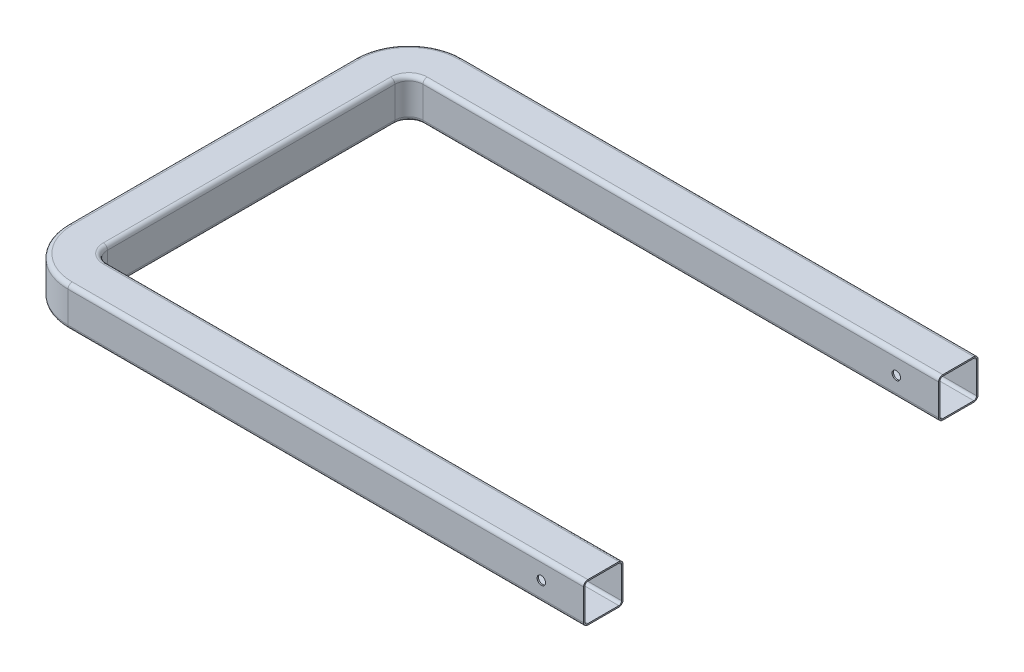
from build123d import *

# Parameters (mm, degrees)
CUT_EXTRUDE1_DEPTH      = 807.538695741
CUT_EXTRUDE1_DEPTH_BACK = 807.538695741
SKETCH3_R               = 5


with BuildPart() as part:
    # Sweep-Thin1: sweep along a path in Sketch1
    with BuildLine(Plane(origin=(0, 0, 0), x_dir=(1, 0, 0), z_dir=(0, 1, 0))) as sweep_thin1_path:
        Line((0, 0), (-610, 0))
        ThreePointArc((-610, 0), (-638.284271247, 11.715728753), (-650, 40))
        Line((-650, 40), (-650, 380))
        ThreePointArc((-650, 380), (-638.284271247, 408.284271247), (-610, 420))
        Line((-610, 420), (0, 420))
    # Sketch2 → Sweep-Thin1 (sweep)
    with BuildSketch(Plane(origin=(0, 0, 0), x_dir=(0, 0, -1), z_dir=(1, 0, 0))):
        with BuildLine():
            Line((18.35, 23.35), (-18.35, 23.35))
            ThreePointArc((-18.35, 23.35), (-21.885533906, 21.885533906), (-23.35, 18.35))
            Line((-23.35, 18.35), (-23.35, -18.35))
            ThreePointArc((-23.35, -18.35), (-21.885533906, -21.885533906), (-18.35, -23.35))
            Line((-18.35, -23.35), (18.35, -23.35))
            ThreePointArc((18.35, -23.35), (21.885533906, -21.885533906), (23.35, -18.35))
            Line((23.35, -18.35), (23.35, 18.35))
            ThreePointArc((23.35, 18.35), (21.885533906, 21.885533906), (18.35, 23.35))
        make_face()
        with BuildLine():
            Line((18.35, 21.7), (-18.35, 21.7))
            ThreePointArc((-18.35, 21.7), (-20.718807717, 20.718807717), (-21.7, 18.35))
            Line((-21.7, 18.35), (-21.7, -18.35))
            ThreePointArc((-21.7, -18.35), (-20.718807717, -20.718807717), (-18.35, -21.7))
            Line((-18.35, -21.7), (18.35, -21.7))
            ThreePointArc((18.35, -21.7), (20.718807717, -20.718807717), (21.7, -18.35))
            Line((21.7, -18.35), (21.7, 18.35))
            ThreePointArc((21.7, 18.35), (20.718807717, 20.718807717), (18.35, 21.7))
        make_face(mode=Mode.SUBTRACT)
    sweep(path=sweep_thin1_path.line)

    # Sketch3 → Cut-Extrude1 (cut, two sides: drawn at the far end of the back side and taken through both)
    with BuildSketch(Plane.XY.offset(-CUT_EXTRUDE1_DEPTH_BACK)):
        with Locations((-50, 0)):
            Circle(SKETCH3_R)
    extrude(amount=CUT_EXTRUDE1_DEPTH + CUT_EXTRUDE1_DEPTH_BACK, mode=Mode.SUBTRACT)


solid = part.part
